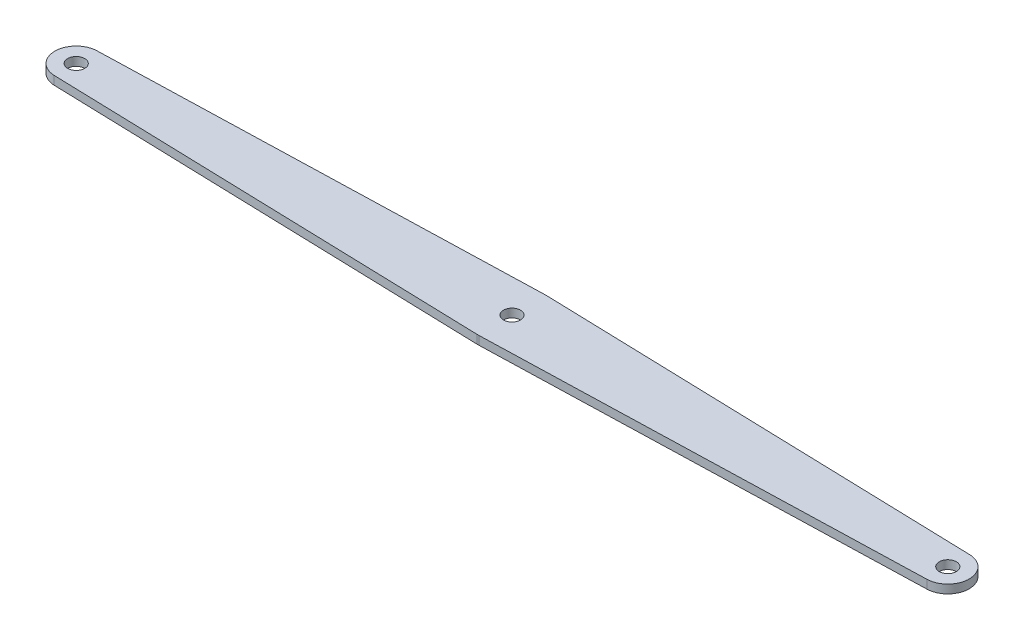
from build123d import *

# Parameters (mm, degrees)
EXTRUDE_447_DEPTH     = 2
SKETCH_2_R            = 2
CUT_EXTRUDE_658_DEPTH = 108.317028643
SKETCH_3_R            = 2
CUT_EXTRUDE_884_DEPTH = 108.317028643


with BuildPart() as part:
    # Эскиз1 → Extrude 447 (new body)
    with BuildSketch(Plane(origin=(0, 0, 0), x_dir=(1, 0, 0), z_dir=(0, 1, 0))):
        with BuildLine():
            Line((-102.147058824, 4.997836902), (-0.235294118, 7.996539044))
            Line((-0.235294118, 7.996539044), (0.235294118, 7.996539044))
            Line((0.235294118, 7.996539044), (102.147058824, 4.997836902))
            ThreePointArc((102.147058824, 4.997836902), (107, 0), (102.147058824, -4.997836902))
            Line((102.147058824, -4.997836902), (0.235294118, -7.996539044))
            Line((0.235294118, -7.996539044), (-0.235294118, -7.996539044))
            Line((-0.235294118, -7.996539044), (-102.147058824, -4.997836902))
            ThreePointArc((-102.147058824, -4.997836902), (-107, 0), (-102.147058824, 4.997836902))
        make_face()
    extrude(amount=EXTRUDE_447_DEPTH)

    # Эскиз2 → Cut-Extrude 658 (cut, through all)
    with BuildSketch(Plane(origin=(0, 2, 0), x_dir=(1, 0, 0), z_dir=(0, 1, 0))):
        Circle(SKETCH_2_R)
    extrude(amount=-CUT_EXTRUDE_658_DEPTH, mode=Mode.SUBTRACT)

    # Эскиз3 → Cut-Extrude 884 (cut, through all)
    with BuildSketch(Plane(origin=(0, 2, 0), x_dir=(1, 0, 0), z_dir=(0, 1, 0))):
        with Locations((-102, 0)):
            Circle(SKETCH_3_R)
        with Locations((102, 0)):
            Circle(SKETCH_3_R)
    extrude(amount=-CUT_EXTRUDE_884_DEPTH, mode=Mode.SUBTRACT)


solid = part.part
